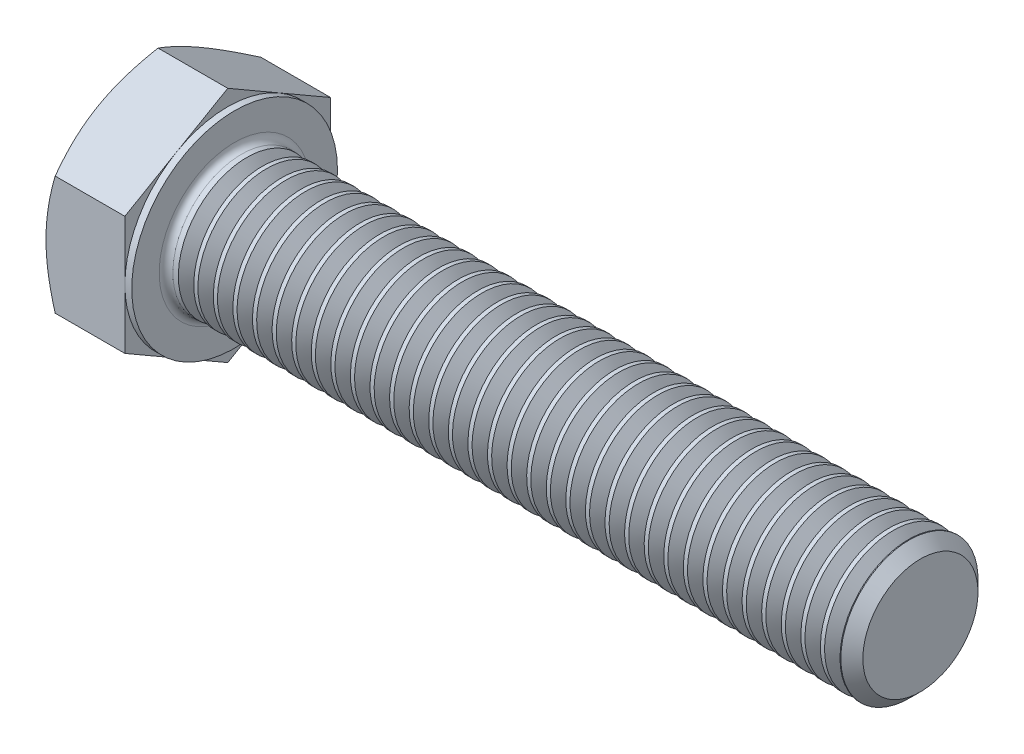
from build123d import *

# Parameters (mm, degrees)
BASEHEAD_DEPTH  = 7.5
BASEBODY_START  = 6.9
BASEBODY_DEPTH  = 0.6
HEADFILLET_R    = 0.6
THDSCHPAT_COUNT = 34
THDSCHPAT_PITCH = 1.713235294


# Read off the part's stored shape, not the designer's step: BearingFace, BaseBody
with BuildPart() as part:
    # Sketch1 → BaseHead (new body)
    with BuildSketch(Plane(origin=(0, 0, 0), x_dir=(0, 0, -1), z_dir=(1, 0, 0))):
        Polygon((9, 5.196152423), (9, -5.196152423), (0, -10.392304845), (-9, -5.196152423), (-9, 5.196152423), (0, 10.392304845), align=None)
    extrude(amount=BASEHEAD_DEPTH)

    # BearingFace outline → BearingFace (revolve)
    with BuildSketch(Plane.YX):
        Polygon((6, 7.5), (6, 66.536), (5.036, 67.5), (0, 67.5), (0, 7.5), align=None)
    revolve(axis=Axis((0, 0, 0), (1, 0, 0)))

    # Sketch3 → HeadChamfer (revolve, cut)
    with BuildSketch(Plane.XY, mode=Mode.PRIVATE) as headchamfer_sk:
        Polygon((0, 9), (3.690598923, 15.392304845), (3.690598923, 20.392304845), (-10, 20.392304845), (-10, 9), align=None)
    revolve(headchamfer_sk.sketch.rotate(Axis((0, 0, 0), (1, 0, 0)), 90), axis=Axis((0, 0, 0), (1, 0, 0)), mode=Mode.SUBTRACT)

    # BaseBody outline → BaseBody (cut)
    with BuildSketch(Plane.YZ.offset(BASEBODY_START)):
        with BuildLine():
            ThreePointArc((7.794228634, 4.5), (9, 0), (7.794228634, -4.499999999))
            Line((7.794228634, -4.499999999), (10.392304845, 0))
            Line((10.392304845, 0), (7.794228634, 4.5))
        make_face()
        with BuildLine():
            ThreePointArc((0, 9), (4.5, 7.794228634), (7.794228634, 4.5))
            Line((7.794228634, 4.5), (5.196152423, 9))
            Line((5.196152423, 9), (0, 9))
        make_face()
        with BuildLine():
            Line((5.196152423, -9), (7.794228634, -4.499999999))
            ThreePointArc((7.794228634, -4.499999999), (4.5, -7.794228634), (0, -9))
            Line((0, -9), (5.196152423, -9))
        make_face()
        with BuildLine():
            ThreePointArc((-7.794228634, 4.5), (-4.5, 7.794228634), (0, 9))
            Line((0, 9), (-5.196152423, 9))
            Line((-5.196152423, 9), (-7.794228634, 4.5))
        make_face()
        with BuildLine():
            Line((-5.196152423, -9), (0, -9))
            ThreePointArc((0, -9), (-4.5, -7.794228634), (-7.794228634, -4.5))
            Line((-7.794228634, -4.5), (-5.196152423, -9))
        make_face()
        with BuildLine():
            ThreePointArc((-7.794228634, -4.5), (-9, 0), (-7.794228634, 4.5))
            Line((-7.794228634, 4.5), (-10.392304845, 0))
            Line((-10.392304845, 0), (-7.794228634, -4.5))
        make_face()
    extrude(amount=BASEBODY_DEPTH, mode=Mode.SUBTRACT)

    # HeadFillet
    headfillet_edges = [part.edges().sort_by_distance(p)[0] for p in [
        (7.5, -6, 0),
    ]]
    fillet(headfillet_edges, radius=HEADFILLET_R)

    # ThdSchSke → ThreadSchematic (revolve, cut)
    with BuildSketch(Plane.XY):
        Polygon((9.25, -5.036), (8.574999933, -6), (8.574999933, -7.5), (9.925000067, -7.5), (9.925000067, -6), align=None)
    threadschematic = revolve(axis=Axis((-3.175, 0, 0), (1, 0, 0)), mode=Mode.SUBTRACT)

    # ThdSchPat: ThreadSchematic ×34
    with Locations(*[(i * THDSCHPAT_PITCH, 0, 0) for i in range(1, THDSCHPAT_COUNT)]):
        add(threadschematic, mode=Mode.SUBTRACT)


solid = part.part
